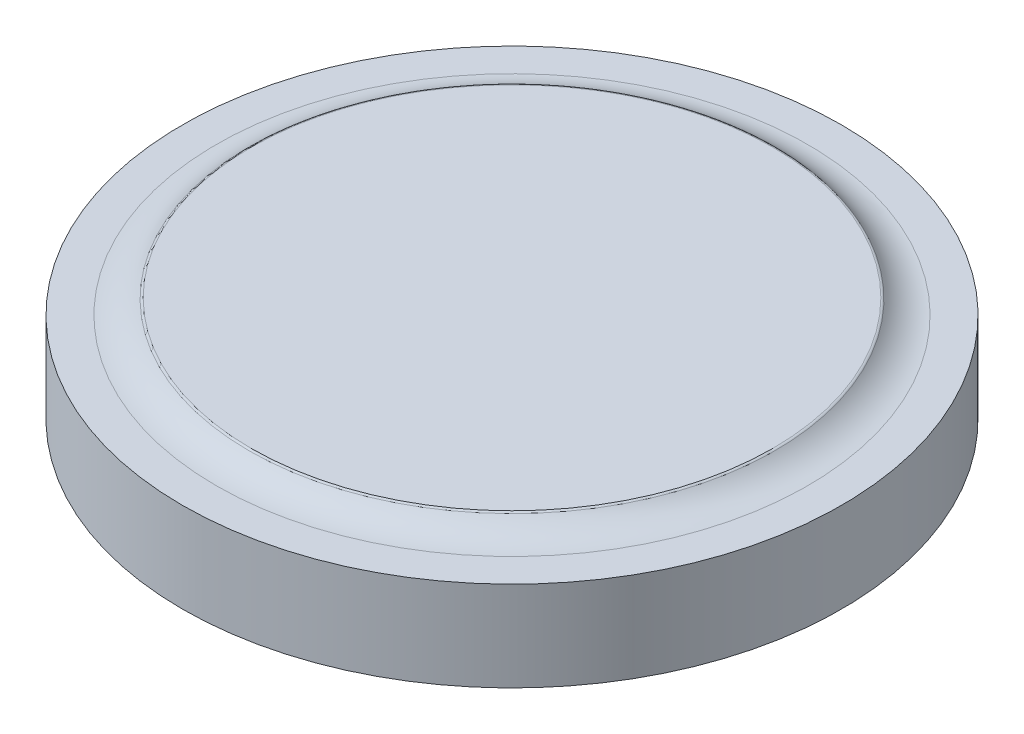
from build123d import *

# Parameters (mm, degrees)
SKETCH_1_R      = 11
EXTRUDE_1_DEPTH = 3
SKETCH_2_R      = 8.75
EXTRUDE_2_DEPTH = 0.5
FILLET_1_R      = 1.5
FILLET_2_R      = 0.1


with BuildPart() as part:
    # 草图1 → 凸台-拉伸1 (new body)
    with BuildSketch(Plane(origin=(0, 0, 0), x_dir=(1, 0, 0), z_dir=(0, 1, 0))):
        with Locations(Location((0, 0, 0), (0, 0, 270))):
            Circle(SKETCH_1_R)
    extrude(amount=EXTRUDE_1_DEPTH)

    # 草图2 → 凸台-拉伸2 (add)
    with BuildSketch(Plane(origin=(0, 3, 0), x_dir=(1, 0, 0), z_dir=(0, 1, 0))):
        with Locations(Location((0, 0, 0), (0, 0, 270))):
            Circle(SKETCH_2_R)
    extrude(amount=EXTRUDE_2_DEPTH)

    # 圆角1
    # the kernel refuses this fillet: 1.5 mm, written as the material it adds along each edge
    with BuildSketch(Plane(origin=(0, 3, 0), x_dir=(0, 0, 1), z_dir=(-1, 0, 0))) as fillet_1_piece_1:
        with BuildLine():
            CenterArc((9.868033989, 1.5), FILLET_1_R, 221.810314896, 48.189685104)
            Line((8.75, 0.5), (8.72763932, 0.48))
            ThreePointArc((8.72763932, 0.48), (8.72, 0.25), (8.72, 0))
            Line((8.72, 0), (8.75, -0.03))
            Line((8.75, -0.03), (9.868033989, -0.03))
            Line((9.868033989, -0.03), (9.868033989, 0))
        make_face()
    revolve(axis=Axis((0, 3, 0), (0, 1, 0)))

    # 圆角2
    fillet_2_edges = [part.edges().sort_by_distance(p)[0] for p in [
        (0, 3.5, -8.75),
    ]]
    fillet(fillet_2_edges, radius=FILLET_2_R)


solid = part.part
